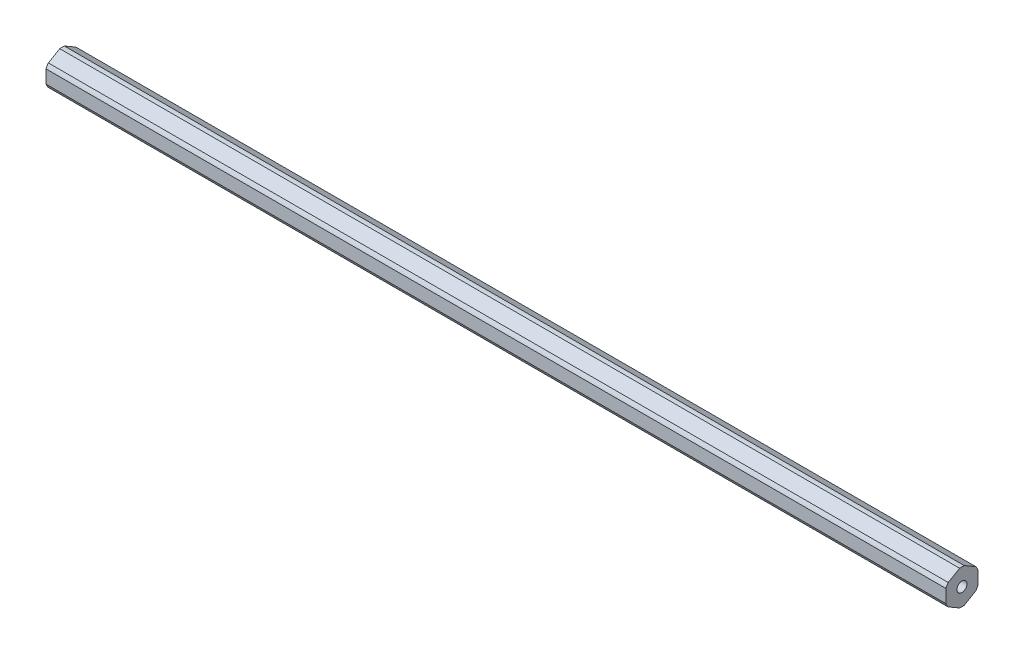
from build123d import *

# Parameters (mm, degrees)
SKETCH1_R           = 1.9939
BOSS_EXTRUDE1_DEPTH = 177.8


with BuildPart() as part:
    # Sketch1 → Boss-Extrude1 (new, symmetric)
    with BuildSketch(Plane(origin=(914.4, 0, 0), x_dir=(0, 0, -1), z_dir=(1, 0, 0))):
        with BuildLine():
            Line((-5.43426841, -4.194872089), (-0.91573159, -6.803650539))
            ThreePointArc((-0.91573159, -6.803650539), (0, -6.865), (0.91573159, -6.803650539))
            Line((0.91573159, -6.803650539), (5.43426841, -4.194872089))
            ThreePointArc((5.43426841, -4.194872089), (5.945264397, -3.4325), (6.35, -2.60877845))
            Line((6.35, -2.60877845), (6.35, 2.60877845))
            ThreePointArc((6.35, 2.60877845), (5.945264397, 3.4325), (5.43426841, 4.194872089))
            Line((5.43426841, 4.194872089), (0.91573159, 6.803650539))
            ThreePointArc((0.91573159, 6.803650539), (0, 6.865), (-0.91573159, 6.803650539))
            Line((-0.91573159, 6.803650539), (-5.43426841, 4.194872089))
            ThreePointArc((-5.43426841, 4.194872089), (-5.945264397, 3.4325), (-6.35, 2.60877845))
            Line((-6.35, 2.60877845), (-6.35, -2.60877845))
            ThreePointArc((-6.35, -2.60877845), (-5.945264397, -3.4325), (-5.43426841, -4.194872089))
        make_face()
        Circle(SKETCH1_R, mode=Mode.SUBTRACT)
    extrude(amount=BOSS_EXTRUDE1_DEPTH, both=True)


solid = part.part
